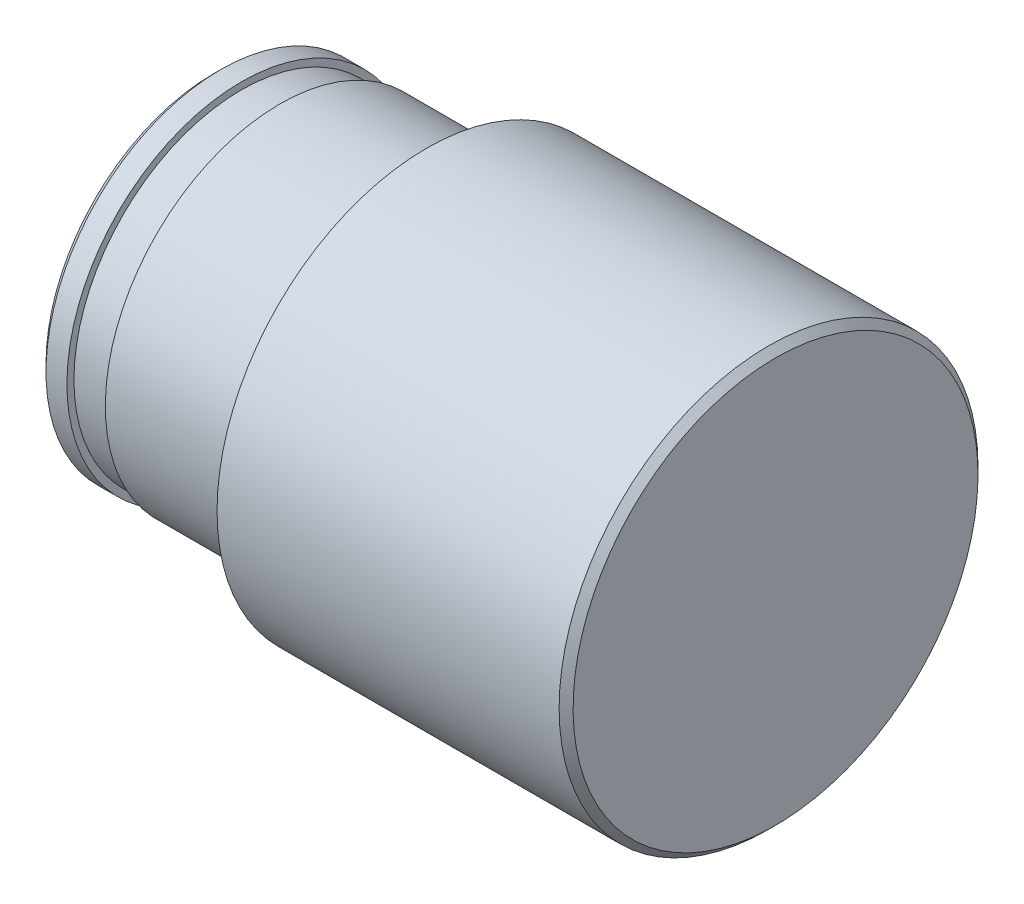
from build123d import *

# Parameters (mm, degrees)
FASE1_SIZE = 0.2


with BuildPart() as part:
    # Skizze2 → Rotation1 (revolve)
    with BuildSketch(Plane.XY):
        Polygon((3.656451613, 0), (-12.443548387, 0), (-12.443548387, 5), (-11.643548387, 5), (-11.643548387, 4.8), (-10.543548387, 4.8), (-10.543548387, 5), (-6.343548387, 5), (-6.343548387, 6), (3.656451613, 6), align=None)
    revolve(axis=Axis((3.656451613, 0, 0), (-1, 0, 0)))

    # Fase1
    fase1_edges = [part.edges().sort_by_distance(p)[0] for p in [
        (3.656451613, -6, 0),
        (-12.443548387, -5, 0),
    ]]
    chamfer(fase1_edges, length=FASE1_SIZE)


solid = part.part
